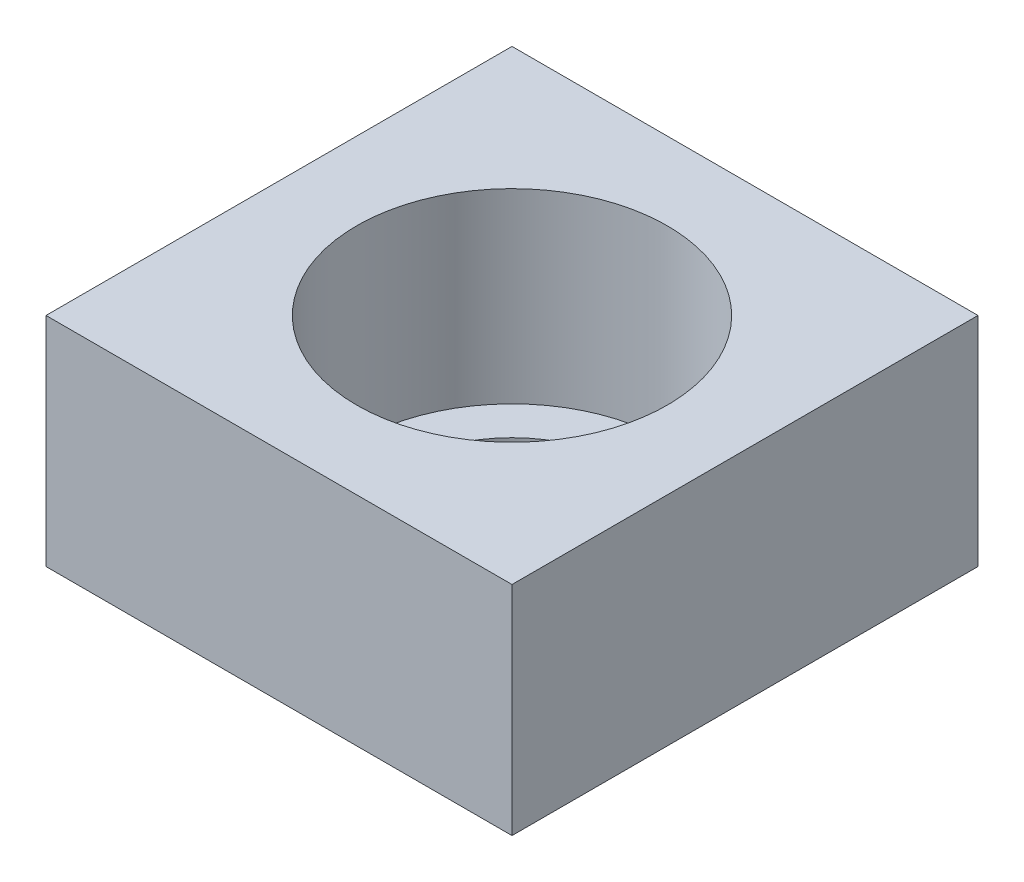
from build123d import *

# Parameters (mm, degrees)
SKETCH2_W           = 45
SKETCH2_H           = 45
SKETCH2_R           = 11
BOSS_EXTRUDE1_DEPTH = 21
SKETCH3_R           = 15
CUT_EXTRUDE1_DEPTH  = 18


with BuildPart() as part:
    # Sketch2 → Boss-Extrude1 (new body)
    with BuildSketch(Plane(origin=(0, 0, 0), x_dir=(1, 0, 0), z_dir=(0, 1, 0))):
        Rectangle(SKETCH2_W, SKETCH2_H)
        Circle(SKETCH2_R, mode=Mode.SUBTRACT)
    extrude(amount=BOSS_EXTRUDE1_DEPTH)

    # Sketch3 → Cut-Extrude1 (cut)
    with BuildSketch(Plane(origin=(0, 21, 0), x_dir=(1, 0, 0), z_dir=(0, 1, 0))):
        Circle(SKETCH3_R)
    extrude(amount=-CUT_EXTRUDE1_DEPTH, mode=Mode.SUBTRACT)


solid = part.part
